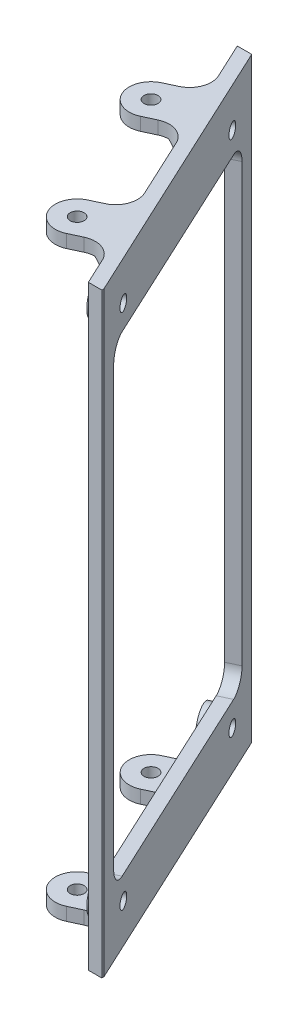
from build123d import *

# Parameters (mm, degrees)
BOSS_EXTRU_1_DEPTH      = 68.25
ESQUISSE2_R             = 1.6
ENL_V_MAT_EXTRU_2_DEPTH = 99.817350207
ESQUISSE9_R             = 3.6
ESQUISSE9_R_2           = 1.6
BOSS_EXTRU_2_DEPTH      = 2
ESQUISSE12_R            = 1.6
BOSS_EXTRU_4_DEPTH      = 3
CHANFREIN1_SIZE         = 3
CONG_1_R                = 5


with BuildPart() as part:
    # Esquisse1 → Boss.-Extru.1 (new, symmetric)
    with BuildSketch(Plane(origin=(0, 0, 0), x_dir=(1, 0, 0), z_dir=(0, 1, 0))):
        Polygon((-0.358056567, 0.767854785), (2.718923361, 0.767854785), (2.718923361, 1.267854785), (-26.864354961, 64.709399878), (-30.174488718, 64.709399878), align=None)
    extrude(amount=BOSS_EXTRU_1_DEPTH, both=True)

    # Esquisse2 → Enlèv. mat.-Extru.2 (cut, through all)
    with BuildSketch(Plane(origin=(2.718923361, 0, -1.267854785), x_dir=(-0.42261826174069733, 0, -0.906307787036651), z_dir=(0.9063077870366509, 0, -0.4226182617406973))):
        with Locations((60.81, 59.31)):
            Circle(ESQUISSE2_R)
        with Locations((9.19, 59.31)):
            Circle(ESQUISSE2_R)
        with Locations((60.81, -59.31)):
            Circle(ESQUISSE2_R)
        with Locations((9.19, -59.31)):
            Circle(ESQUISSE2_R)
        with BuildLine():
            Line((61.4, 54.025), (8.6, 54.025))
            ThreePointArc((8.6, 54.025), (5.771572875, 52.853427125), (4.6, 50.025))
            Line((4.6, 50.025), (4.6, -50.025))
            ThreePointArc((4.6, -50.025), (5.771572875, -52.853427125), (8.6, -54.025))
            Line((8.6, -54.025), (61.4, -54.025))
            ThreePointArc((61.4, -54.025), (64.228427125, -52.853427125), (65.4, -50.025))
            Line((65.4, -50.025), (65.4, 50.025))
            ThreePointArc((65.4, 50.025), (64.228427125, 52.853427125), (61.4, 54.025))
        make_face()
    extrude(amount=-ENL_V_MAT_EXTRU_2_DEPTH, mode=Mode.SUBTRACT)

    # Esquisse9 → Boss.-Extru.2 (add)
    # profile 1 of 4: a face of its own
    with BuildSketch(Plane(origin=(0, 0, 0), x_dir=(0.42261826174069717, 0, 0.906307787036651), z_dir=(-0.906307787036651, 0, 0.42261826174069717))):
        with Locations((-60.81, -59.31)):
            Circle(ESQUISSE9_R)
        with Locations(Location((-60.81, -59.31, 0), (0, 0, 180))):
            Circle(ESQUISSE9_R_2, mode=Mode.SUBTRACT)
    # profile 2 of 4: a face of its own
    with BuildSketch(Plane(origin=(0, 0, 0), x_dir=(0.42261826174069717, 0, 0.906307787036651), z_dir=(-0.906307787036651, 0, 0.42261826174069717))):
        with Locations((-9.19, -59.31)):
            Circle(ESQUISSE9_R)
        with Locations(Location((-9.19, -59.31, 0), (0, 0, 180))):
            Circle(ESQUISSE9_R_2, mode=Mode.SUBTRACT)
    # profile 3 of 4: a face of its own
    with BuildSketch(Plane(origin=(0, 0, 0), x_dir=(0.42261826174069717, 0, 0.906307787036651), z_dir=(-0.906307787036651, 0, 0.42261826174069717))):
        with Locations((-60.81, 59.31)):
            Circle(ESQUISSE9_R)
        with Locations(Location((-60.81, 59.31, 0), (0, 0, 180))):
            Circle(ESQUISSE9_R_2, mode=Mode.SUBTRACT)
    # profile 4 of 4: a face of its own
    with BuildSketch(Plane(origin=(0, 0, 0), x_dir=(0.42261826174069717, 0, 0.906307787036651), z_dir=(-0.906307787036651, 0, 0.42261826174069717))):
        with Locations((-9.19, 59.31)):
            Circle(ESQUISSE9_R)
        with Locations(Location((-9.19, 59.31, 0), (0, 0, 180))):
            Circle(ESQUISSE9_R_2, mode=Mode.SUBTRACT)
    extrude(amount=BOSS_EXTRU_2_DEPTH)

    # Esquisse12 → Boss.-Extru.4 (add)
    # profile 1 of 2: a face of its own
    with BuildSketch(Plane(origin=(0, 68.25, 0), x_dir=(1, 0, 0), z_dir=(0, 1, 0))):
        Polygon((-24.30483409, 52.121884907), (-20.078651472, 43.058807037), (-31.860652704, 37.564769634), (-36.086835321, 46.627847504), align=None)
        with Locations(Location((-29.442205077, 44.209399878, 0), (0, 0, 270))):
            Circle(ESQUISSE12_R, mode=Mode.SUBTRACT)
    # profile 2 of 2: a face of its own
    with BuildSketch(Plane(origin=(0, 68.25, 0), x_dir=(1, 0, 0), z_dir=(0, 1, 0))):
        Polygon((-9.513194929, 20.401112361), (-5.287012311, 11.33803449), (-17.069013543, 5.843997088), (-21.29519616, 14.907074958), align=None)
        with Locations(Location((-14.650565916, 12.488627332, 0), (0, 0, 270))):
            Circle(ESQUISSE12_R, mode=Mode.SUBTRACT)
    boss_extru_4 = extrude(amount=-BOSS_EXTRU_4_DEPTH)

    # Symétrie1: Boss.-Extru.4 across plane
    add(boss_extru_4.mirror(Plane.ZX))

    # Chanfrein1
    chanfrein1_edges = [part.edges().sort_by_distance(p)[0] for p in [
        (-22.191742781, 65.25, -47.590345972),
        (-7.40010362, 65.25, -15.869573425),
        (-22.191742781, -65.25, -47.590345972),
        (-7.40010362, -65.25, -15.869573425),
    ]]
    chamfer(chanfrein1_edges, length=CHANFREIN1_SIZE)

    # Congé1
    # the kernel refuses this fillet: 5 mm, written as the material it adds along each edge
    with BuildSketch(Plane(origin=(-5.287012311, -49.75, -11.33803449), x_dir=(0.422618261740698, 0, 0.9063077870366506), z_dir=(0, -1, 0))) as cong_1_piece_1_section:
        with BuildLine():
            CenterArc((CONG_1_R, CONG_1_R), CONG_1_R, 180, 90)
            Line((0, CONG_1_R), (0, 0))
            Line((0, 0), (CONG_1_R, 0))
        make_face()
    cong_1_piece_1 = extrude(amount=18.5, mode=Mode.PRIVATE)
    cong_1_piece_1 = split(cong_1_piece_1, bisect_by=Plane(origin=(-5.847164169, -63.503441979, -9.573387631), z_dir=(0.6408563820557893, -0.7071067811865476, -0.2988362387301183)), keep=Keep.TOP, mode=Mode.PRIVATE)
    add(cong_1_piece_1)
    with BuildSketch(Plane(origin=(-5.287012311, -49.75, -11.33803449), x_dir=(0.422618261740698, 0, 0.9063077870366506), z_dir=(0, -1, 0))) as cong_1_piece_2_section:
        with BuildLine():
            CenterArc((CONG_1_R, CONG_1_R), CONG_1_R, 180, 90)
            Line((0, CONG_1_R), (0, 0))
            Line((0, 0), (CONG_1_R, 0))
        make_face()
    cong_1_piece_2 = extrude(amount=18.5, mode=Mode.PRIVATE)
    cong_1_piece_2 = split(cong_1_piece_2, bisect_by=Plane(origin=(-8.692712143, -65.25, -9.659141323), z_dir=(0, -1, 0)), keep=Keep.TOP, mode=Mode.PRIVATE)
    add(cong_1_piece_2)
    with BuildSketch(Plane(origin=(-9.513194929, -68.25, -20.401112361), x_dir=(-0.42261826174069805, 0, -0.9063077870366507), z_dir=(0, 1, 0))) as cong_1_piece_3_section:
        with BuildLine():
            CenterArc((CONG_1_R, CONG_1_R), CONG_1_R, 180, 90)
            Line((0, CONG_1_R), (0, 0))
            Line((0, 0), (CONG_1_R, 0))
        make_face()
    cong_1_piece_3 = extrude(amount=18.5, mode=Mode.PRIVATE)
    cong_1_piece_3 = split(cong_1_piece_3, bisect_by=Plane(origin=(-12.528126804, -65.051720555, -20.237219019), z_dir=(0.6408563820557893, -0.7071067811865476, -0.2988362387301183)), keep=Keep.TOP, mode=Mode.PRIVATE)
    add(cong_1_piece_3)
    with BuildSketch(Plane(origin=(-9.513194929, -68.25, -20.401112361), x_dir=(-0.42261826174069805, 0, -0.9063077870366507), z_dir=(0, 1, 0))) as cong_1_piece_4_section:
        with BuildLine():
            CenterArc((CONG_1_R, CONG_1_R), CONG_1_R, 180, 90)
            Line((0, CONG_1_R), (0, 0))
            Line((0, 0), (CONG_1_R, 0))
        make_face()
    cong_1_piece_4 = extrude(amount=18.5, mode=Mode.PRIVATE)
    cong_1_piece_4 = split(cong_1_piece_4, bisect_by=Plane(origin=(-12.988443364, -65.25, -18.871366656), z_dir=(0, -1, 0)), keep=Keep.TOP, mode=Mode.PRIVATE)
    add(cong_1_piece_4)
    with BuildSketch(Plane(origin=(-20.078651472, -49.75, -43.058807037), x_dir=(0.4226182617406975, 1.3235243039690182e-15, 0.9063077870366509), z_dir=(0, -1, 0))) as cong_1_piece_5_section:
        with BuildLine():
            CenterArc((CONG_1_R, CONG_1_R), CONG_1_R, 180, 90)
            Line((0, CONG_1_R), (0, 0))
            Line((0, 0), (CONG_1_R, 0))
        make_face()
    cong_1_piece_5 = extrude(amount=18.5, mode=Mode.PRIVATE)
    cong_1_piece_5 = split(cong_1_piece_5, bisect_by=Plane(origin=(-23.484351304, -65.25, -41.379913869), z_dir=(0, -1, 0)), keep=Keep.TOP, mode=Mode.PRIVATE)
    add(cong_1_piece_5)
    with BuildSketch(Plane(origin=(-20.078651472, -49.75, -43.058807037), x_dir=(0.4226182617406975, 1.3235243039690182e-15, 0.9063077870366509), z_dir=(0, -1, 0))) as cong_1_piece_6_section:
        with BuildLine():
            CenterArc((CONG_1_R, CONG_1_R), CONG_1_R, 180, 90)
            Line((0, CONG_1_R), (0, 0))
            Line((0, 0), (CONG_1_R, 0))
        make_face()
    cong_1_piece_6 = extrude(amount=18.5, mode=Mode.PRIVATE)
    cong_1_piece_6 = split(cong_1_piece_6, bisect_by=Plane(origin=(-20.647866522, -63.51880747, -41.277238406), z_dir=(0.6408563820557893, -0.7071067811865477, -0.2988362387301182)), keep=Keep.TOP, mode=Mode.PRIVATE)
    add(cong_1_piece_6)
    with BuildSketch(Plane(origin=(-24.30483409, -68.25, -52.121884907), x_dir=(-0.4226182617406975, -1.3235243039690182e-15, -0.9063077870366509), z_dir=(0, 1, 0))) as cong_1_piece_7_section:
        with BuildLine():
            CenterArc((CONG_1_R, CONG_1_R), CONG_1_R, 180, 90)
            Line((0, CONG_1_R), (0, 0))
            Line((0, 0), (CONG_1_R, 0))
        make_face()
    cong_1_piece_7 = extrude(amount=18.5, mode=Mode.PRIVATE)
    cong_1_piece_7 = split(cong_1_piece_7, bisect_by=Plane(origin=(-27.23858246, -64.883026529, -52.183057049), z_dir=(0.6408563820557893, -0.7071067811865477, -0.2988362387301182)), keep=Keep.TOP, mode=Mode.PRIVATE)
    add(cong_1_piece_7)
    with BuildSketch(Plane(origin=(-24.30483409, -68.25, -52.121884907), x_dir=(-0.4226182617406975, -1.3235243039690182e-15, -0.9063077870366509), z_dir=(0, 1, 0))) as cong_1_piece_8_section:
        with BuildLine():
            CenterArc((CONG_1_R, CONG_1_R), CONG_1_R, 180, 90)
            Line((0, CONG_1_R), (0, 0))
            Line((0, 0), (CONG_1_R, 0))
        make_face()
    cong_1_piece_8 = extrude(amount=18.5, mode=Mode.PRIVATE)
    cong_1_piece_8 = split(cong_1_piece_8, bisect_by=Plane(origin=(-27.780082525, -65.25, -50.592139202), z_dir=(0, -1, 0)), keep=Keep.TOP, mode=Mode.PRIVATE)
    add(cong_1_piece_8)
    with BuildSketch(Plane(origin=(-5.287012311, 68.25, -11.33803449), x_dir=(0.4226182617406971, 0, 0.906307787036651), z_dir=(0, -1, 0))) as cong_1_piece_9_section:
        with BuildLine():
            CenterArc((CONG_1_R, CONG_1_R), CONG_1_R, 180, 90)
            Line((0, CONG_1_R), (0, 0))
            Line((0, 0), (CONG_1_R, 0))
        make_face()
    cong_1_piece_9 = extrude(amount=18.5, mode=Mode.PRIVATE)
    cong_1_piece_9 = split(cong_1_piece_9, bisect_by=Plane(origin=(-7.125928834, 64.883026529, -9.051332159), z_dir=(0.6408563820557893, 0.7071067811865476, -0.2988362387301183)), keep=Keep.TOP, mode=Mode.PRIVATE)
    add(cong_1_piece_9)
    with BuildSketch(Plane(origin=(-5.287012311, 68.25, -11.33803449), x_dir=(0.4226182617406971, 0, 0.906307787036651), z_dir=(0, -1, 0))) as cong_1_piece_10_section:
        with BuildLine():
            CenterArc((CONG_1_R, CONG_1_R), CONG_1_R, 180, 90)
            Line((0, CONG_1_R), (0, 0))
            Line((0, 0), (CONG_1_R, 0))
        make_face()
    cong_1_piece_10 = extrude(amount=18.5, mode=Mode.PRIVATE)
    cong_1_piece_10 = split(cong_1_piece_10, bisect_by=Plane(origin=(-8.692712143, 65.25, -9.659141323), z_dir=(0, 1, 0)), keep=Keep.TOP, mode=Mode.PRIVATE)
    add(cong_1_piece_10)
    with BuildSketch(Plane(origin=(-9.513194929, 49.75, -20.401112361), x_dir=(-0.4226182617406978, 0, -0.9063077870366508), z_dir=(0, 1, 0))) as cong_1_piece_11_section:
        with BuildLine():
            CenterArc((CONG_1_R, CONG_1_R), CONG_1_R, 180, 90)
            Line((0, CONG_1_R), (0, 0))
            Line((0, 0), (CONG_1_R, 0))
        make_face()
    cong_1_piece_11 = extrude(amount=18.5, mode=Mode.PRIVATE)
    cong_1_piece_11 = split(cong_1_piece_11, bisect_by=Plane(origin=(-12.988443364, 65.25, -18.871366656), z_dir=(0, 1, 0)), keep=Keep.TOP, mode=Mode.PRIVATE)
    add(cong_1_piece_11)
    with BuildSketch(Plane(origin=(-9.513194929, 49.75, -20.401112361), x_dir=(-0.4226182617406978, 0, -0.9063077870366508), z_dir=(0, 1, 0))) as cong_1_piece_12_section:
        with BuildLine():
            CenterArc((CONG_1_R, CONG_1_R), CONG_1_R, 180, 90)
            Line((0, CONG_1_R), (0, 0))
            Line((0, 0), (CONG_1_R, 0))
        make_face()
    cong_1_piece_12 = extrude(amount=18.5, mode=Mode.PRIVATE)
    cong_1_piece_12 = split(cong_1_piece_12, bisect_by=Plane(origin=(-11.24384006, 63.51880747, -21.110238576), z_dir=(0.6408563820557893, 0.7071067811865476, -0.2988362387301183)), keep=Keep.TOP, mode=Mode.PRIVATE)
    add(cong_1_piece_12)
    with BuildSketch(Plane(origin=(-24.30483409, 49.75, -52.121884907), x_dir=(-0.4226182617406975, 1.3235243039690182e-15, -0.9063077870366509), z_dir=(0, 1, 0))) as cong_1_piece_13_section:
        with BuildLine():
            CenterArc((CONG_1_R, CONG_1_R), CONG_1_R, 180, 90)
            Line((0, CONG_1_R), (0, 0))
            Line((0, 0), (CONG_1_R, 0))
        make_face()
    cong_1_piece_13 = extrude(amount=18.5, mode=Mode.PRIVATE)
    cong_1_piece_13 = split(cong_1_piece_13, bisect_by=Plane(origin=(-26.016932611, 63.503818008, -52.826705881), z_dir=(0.6408563820557893, 0.7071067811865477, -0.2988362387301182)), keep=Keep.TOP, mode=Mode.PRIVATE)
    add(cong_1_piece_13)
    with BuildSketch(Plane(origin=(-24.30483409, 49.75, -52.121884907), x_dir=(-0.4226182617406975, 1.3235243039690182e-15, -0.9063077870366509), z_dir=(0, 1, 0))) as cong_1_piece_14_section:
        with BuildLine():
            CenterArc((CONG_1_R, CONG_1_R), CONG_1_R, 180, 90)
            Line((0, CONG_1_R), (0, 0))
            Line((0, 0), (CONG_1_R, 0))
        make_face()
    cong_1_piece_14 = extrude(amount=18.5, mode=Mode.PRIVATE)
    cong_1_piece_14 = split(cong_1_piece_14, bisect_by=Plane(origin=(-27.780082525, 65.25, -50.592139202), z_dir=(0, 1, 0)), keep=Keep.TOP, mode=Mode.PRIVATE)
    add(cong_1_piece_14)
    with BuildSketch(Plane(origin=(-20.078651472, 68.25, -43.058807037), x_dir=(0.4226182617406981, -1.323524303969018e-15, 0.9063077870366506), z_dir=(0, -1, 0))) as cong_1_piece_15_section:
        with BuildLine():
            CenterArc((CONG_1_R, CONG_1_R), CONG_1_R, 180, 90)
            Line((0, CONG_1_R), (0, 0))
            Line((0, 0), (CONG_1_R, 0))
        make_face()
    cong_1_piece_15 = extrude(amount=18.5, mode=Mode.PRIVATE)
    cong_1_piece_15 = split(cong_1_piece_15, bisect_by=Plane(origin=(-20.594514955, 65.25, -41.576263464), z_dir=(0, 1, 0)), keep=Keep.TOP, mode=Mode.PRIVATE)
    add(cong_1_piece_15)
    with BuildSketch(Plane(origin=(-20.078651472, 68.25, -43.058807037), x_dir=(0.4226182617406981, -1.323524303969018e-15, 0.9063077870366506), z_dir=(0, -1, 0))) as cong_1_piece_16_section:
        with BuildLine():
            CenterArc((CONG_1_R, CONG_1_R), CONG_1_R, 180, 90)
            Line((0, CONG_1_R), (0, 0))
            Line((0, 0), (CONG_1_R, 0))
        make_face()
    cong_1_piece_16 = extrude(amount=18.5, mode=Mode.PRIVATE)
    cong_1_piece_16 = split(cong_1_piece_16, bisect_by=Plane(origin=(-20.647866522, 63.51880747, -41.277238406), z_dir=(0.6408563820557893, 0.7071067811865477, -0.2988362387301182)), keep=Keep.TOP, mode=Mode.PRIVATE)
    add(cong_1_piece_16)
    # the kernel refuses this fillet: 5 mm, written as the material it takes off along each edge
    with BuildSketch(Plane(origin=(-17.069013543, -80.75, -5.843997088), x_dir=(-0.42261826174069644, 0, -0.9063077870366514), z_dir=(0, 1, 0)), Plane(origin=(-21.29519616, -80.75, -14.907074958), x_dir=(0.9063077870366512, 0, -0.42261826174069694), z_dir=(0, 1, 0)), Plane(origin=(-31.860652704, -80.75, -37.564769634), x_dir=(-0.42261826174069683, 0, -0.9063077870366512), z_dir=(0, 1, 0)), Plane(origin=(-36.086835321, -80.75, -46.627847504), x_dir=(0.906307787036651, 0, -0.42261826174069694), z_dir=(0, 1, 0)), Plane(origin=(-17.069013543, 80.75, -5.843997088), x_dir=(0.9063077870366508, 0, -0.42261826174069783), z_dir=(0, -1, 0)), Plane(origin=(-21.29519616, 80.75, -14.907074958), x_dir=(0.4226182617406976, 0, 0.9063077870366508), z_dir=(0, -1, 0)), Plane(origin=(-31.860652704, 80.75, -37.564769634), x_dir=(0.9063077870366512, 0, -0.42261826174069683), z_dir=(0, -1, 0)), Plane(origin=(-36.086835321, 80.75, -46.627847504), x_dir=(0.42261826174069805, 0, 0.9063077870366507), z_dir=(0, -1, 0))) as cong_1_2_piece_1:
        with BuildLine():
            CenterArc((CONG_1_R, -CONG_1_R), CONG_1_R, 90, 90)
            Line((0, -CONG_1_R), (0, 0))
            Line((0, 0), (CONG_1_R, 0))
        make_face()
    extrude(amount=28, mode=Mode.SUBTRACT)


solid = part.part
